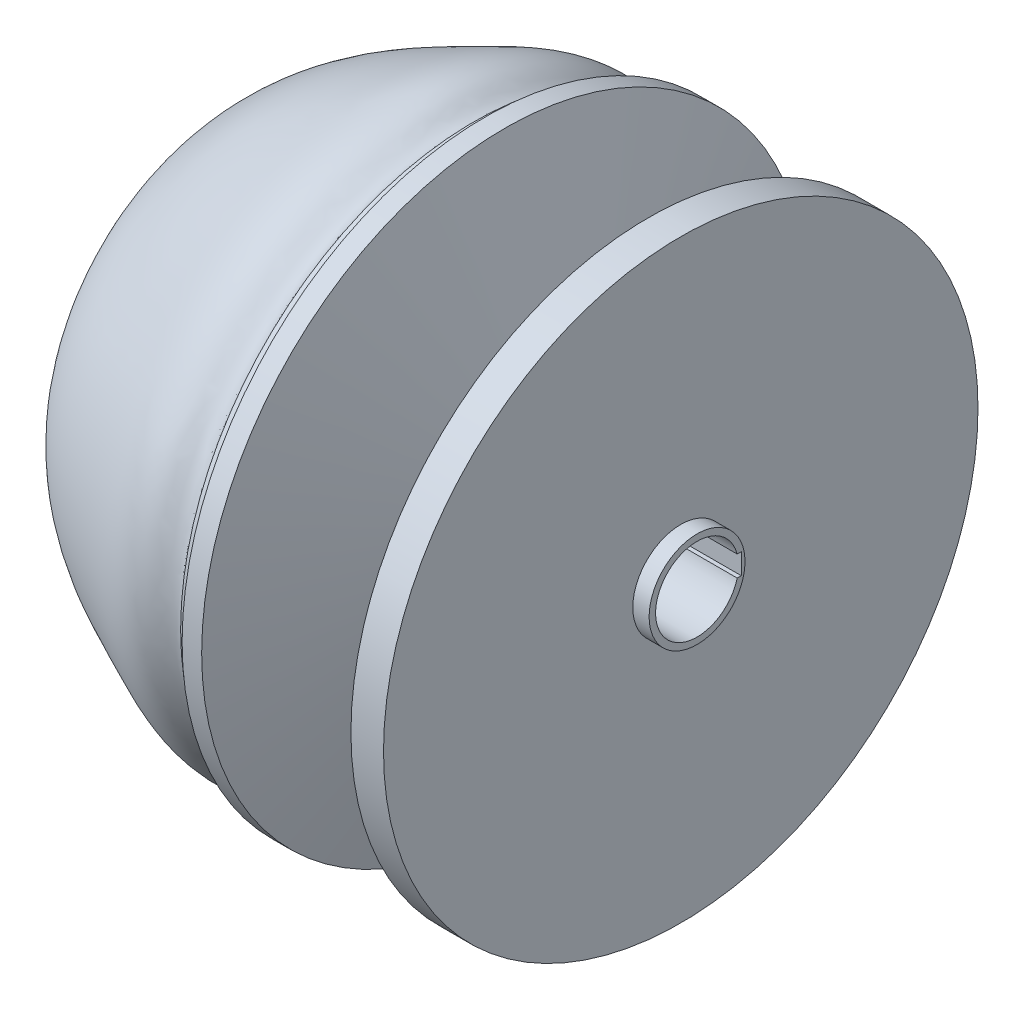
from build123d import *

# Parameters (mm, degrees)
SKETCH2_R          = 12.718
CUT_EXTRUDE1_DEPTH = 82.74
SKETCH3_R          = 10
CUT_EXTRUDE2_DEPTH = 79.507
SKETCH4_W          = 1.691
SKETCH4_H          = 6.375
CUT_EXTRUDE3_DEPTH = 56


with BuildPart() as part:
    # Sketch1 → Revolve1 (revolve)
    with BuildSketch(Plane.XY, mode=Mode.PRIVATE) as revolve1_sk:
        with BuildLine():
            Line((-80.911998208, 0), (-80.911998208, 12.718))
            Line((-80.911998208, 12.718), (-70.911998208, 12.718))
            Line((-70.911998208, 12.718), (-70.911998208, 32.718))
            add(Edge.make_bspline(
                [(-70.911998208, 32.718), (-72.12061009, 49.624927681), (-53.086599537, 70.223127666), (-24.900561644, 82.171389104), (-2.569366769, 92.818520506), (6.899070449, 82.616568551), (10.881080371, 90)],
                knots=[0, 0, 0, 0, 0.424565584, 0.683651406, 0.890381035, 1, 1, 1, 1], degree=3))
            Line((10.881080371, 90), (14.335001792, 90))
            Line((14.335001792, 90), (14.335001792, 93))
            Line((14.335001792, 93), (20.335001792, 93))
            Line((20.335001792, 93), (41.227154337, 15))
            Line((41.227154337, 15), (53.870153491, 15))
            Line((53.870153491, 15), (64.335001792, 91.202154094))
            Line((64.335001792, 91.202154094), (74.335001792, 91.202154094))
            Line((74.335001792, 91.202154094), (74.335001792, 14.709294291))
            Line((74.335001792, 14.709294291), (79.335001792, 14.709294291))
            Line((79.335001792, 14.709294291), (79.335001792, 0))
            Line((79.335001792, 0), (-80.911998208, 0))
        make_face()
    revolve(revolve1_sk.sketch.rotate(Axis((-81.835688806, 0, 0), (1, 0, 0)), 90), axis=Axis((-81.835688806, 0, 0), (1, 0, 0)))

    # Sketch2 → Cut-Extrude1 (cut)
    with BuildSketch(Plane(origin=(79.335001792, 0, 0), x_dir=(0, 0, -1), z_dir=(1, 0, 0))):
        with Locations(Location((0, 0, 0), (0, 0, 180))):
            Circle(SKETCH2_R)
    extrude(amount=-CUT_EXTRUDE1_DEPTH, mode=Mode.SUBTRACT)

    # Sketch3 → Cut-Extrude2 (cut)
    with BuildSketch(Plane.ZY.offset(80.911998208)):
        Circle(SKETCH3_R)
    extrude(amount=-CUT_EXTRUDE2_DEPTH, mode=Mode.SUBTRACT)

    # Chamfer1
    # the kernel refuses this chamfer: 3, 1.732050808 mm, written as the material it takes off along each edge
    with BuildSketch(Plane(origin=(-3.404998208, 0, 0), x_dir=(0, 0, 1), z_dir=(0, -1, 0))) as chamfer1_piece_1_section:
        with BuildLine():
            Line((9.896076952, 1.792050808), (13.103923048, -0.06))
            Line((13.103923048, -0.06), (13.103923048, -0.12))
            ThreePointArc((13.103923048, -0.12), (11.551961524, -0.06), (10, -0.06))
            Line((10, -0.06), (9.94, 0))
            ThreePointArc((9.94, 0), (9.94, 0.896025404), (9.836076952, 1.792050808))
            Line((9.836076952, 1.792050808), (9.896076952, 1.792050808))
        make_face()
    chamfer1_piece_1 = revolve(axis=Axis((-3.404998208, 0, 0), (-1, 0, 0)), mode=Mode.PRIVATE)
    chamfer1_piece_1 = chamfer1_piece_1 & Plane(origin=(-4.331873762, 0, 0), x_dir=(0, 0, 1), z_dir=(1, 0, 0)) * Cylinder(12.718, 53, mode=Mode.PRIVATE)
    add(chamfer1_piece_1, mode=Mode.SUBTRACT)

    # Sketch4 → Cut-Extrude3 (cut)
    with BuildSketch(Plane(origin=(79.335001792, 0, 0), x_dir=(0, 0, -1), z_dir=(1, 0, 0))):
        with Locations((12.718, 0)):
            Rectangle(SKETCH4_W, SKETCH4_H)
    extrude(amount=-CUT_EXTRUDE3_DEPTH, mode=Mode.SUBTRACT)


solid = part.part
